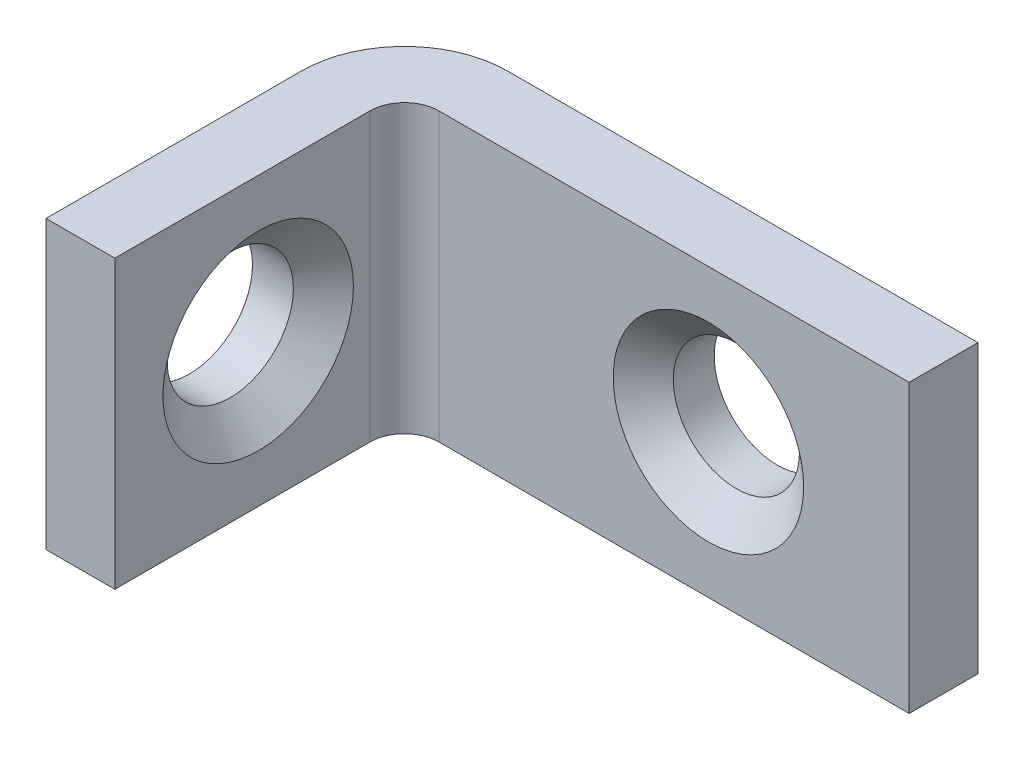
from build123d import *

# Parameters (mm, degrees)
EXTRUDE_THIN1_START = -6.35
EXTRUDE_THIN1_DEPTH = 12.7
SKETCH4_R           = 2.794
EXTRUDE3_DEPTH      = 29.141606724
SKETCH6_R           = 2.794
CUT_EXTRUDE1_DEPTH  = 31.618591166


# Read off the part's stored shape, not the designer's step: Extrude-Thin1
with BuildPart() as part:
    # Extrude-Thin1 outline → Extrude-Thin1 (new body)
    with BuildSketch(Plane(origin=(0, 0, 0), x_dir=(1, 0, 0), z_dir=(0, 1, 0)).offset(EXTRUDE_THIN1_START)):
        with BuildLine():
            Line((4.572, -3.048), (25.4, -3.048))
            Line((25.4, -3.048), (25.4, 0))
            Line((25.4, 0), (4.572, 0))
            ThreePointArc((4.572, 0), (1.339107796, -1.339107796), (0, -4.572))
            Line((0, -4.572), (0, -15.875))
            Line((0, -15.875), (3.048, -15.875))
            Line((3.048, -15.875), (3.048, -4.572))
            ThreePointArc((3.048, -4.572), (3.494369265, -3.494369265), (4.572, -3.048))
        make_face()
    extrude(amount=EXTRUDE_THIN1_DEPTH)

    # Sketch4 → Extrude3 (cut, through all)
    with BuildSketch(Plane(origin=(3.048, 0, 0), x_dir=(0, 0, -1), z_dir=(1, 0, 0))):
        with Locations((-9.525, 0)):
            Circle(SKETCH4_R)
    extrude(amount=-EXTRUDE3_DEPTH, mode=Mode.SUBTRACT)

    # Sketch6 → Cut-Extrude1 (cut, through all)
    with BuildSketch(Plane.XY):
        with Locations(Location((16.51, 0, 0), (0, 0, 180))):
            Circle(SKETCH6_R)
    extrude(amount=CUT_EXTRUDE1_DEPTH, mode=Mode.SUBTRACT)

    # Cut-Extrude2 cone 1 section (through the dimple's axis) → Cut-Extrude2 (revolve, cut)
    with BuildSketch(Plane(origin=(3.048, 0, 9.525), x_dir=(0, 0, -1), z_dir=(0, 1, 0))):
        Polygon((0, 0), (4.2164, 0), (0, 3.665260601), align=None)
    revolve(axis=Axis((3.048, 0, 9.525), (-1, 0, 0)), mode=Mode.SUBTRACT)

    # Cut-Extrude3 cone 1 section (through the dimple's axis) → Cut-Extrude3 (revolve, cut)
    with BuildSketch(Plane(origin=(16.51, 0, 3.048), x_dir=(0, -1, 0), z_dir=(1, 0, 0))):
        Polygon((0, 0), (4.2164, 0), (0, 3.665260601), align=None)
    revolve(axis=Axis((16.51, 0, 3.048), (0, 0, -1)), mode=Mode.SUBTRACT)


solid = part.part
